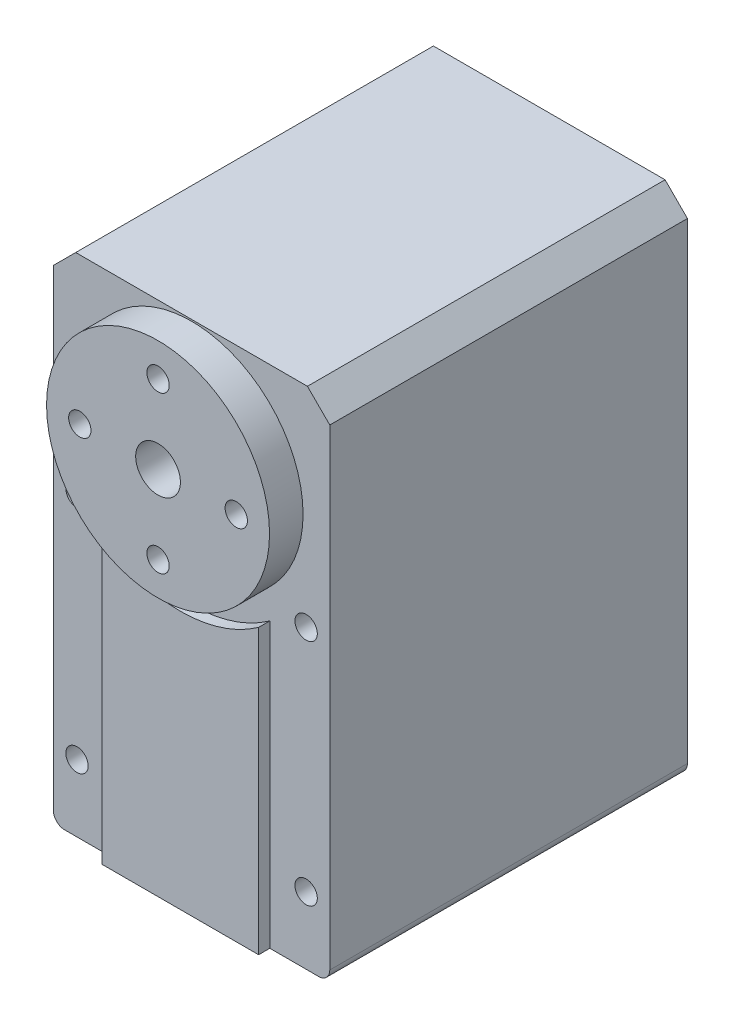
from build123d import *

# Parameters (mm, degrees)
SKETCH_1_W          = 24.73
SKETCH_1_H          = 45.23
EXTRUDE_1_DEPTH     = 32
CHAMFER_1_SIZE      = 2
EXTRUDE_2_DEPTH     = 1
SKETCH_3_R          = 1
CUT_EXTRUDE_1_DEPTH = 4
SKETCH_4_R          = 9.975
EXTRUDE_3_DEPTH     = 3
SKETCH_5_R          = 2
SKETCH_5_R_2        = 1
CUT_EXTRUDE_2_DEPTH = 3
SKETCH_6_W          = 20.33
SKETCH_6_H          = 12
EXTRUDE_4_DEPTH     = 2
CHAMFER_2_SIZE      = 2
SKETCH_7_W          = 22.33
SKETCH_7_H          = 5
CUT_EXTRUDE_3_DEPTH = 2
SKETCH_8_R          = 3
EXTRUDE_5_DEPTH     = 4.1
CUT_EXTRUDE_START   = -4
SKETCH_9_R          = 1
CUT_EXTRUDE_4_DEPTH = 4
FILLET_1_R          = 1


with BuildPart() as part:
    # 스케치1 → 보스-돌출1 (new body)
    with BuildSketch(Plane.XY):
        Rectangle(SKETCH_1_W, SKETCH_1_H)
    extrude(amount=EXTRUDE_1_DEPTH)

    # 모따기1
    chamfer_1_edges = [part.edges().sort_by_distance(p)[0] for p in [
        (-12.365, 22.615, 16),
        (12.365, 22.615, 16),
    ]]
    chamfer(chamfer_1_edges, length=CHAMFER_1_SIZE)

    # 스케치2 → 보스-돌출2 (add)
    with BuildSketch(Plane.XY.offset(32)):
        with BuildLine():
            Line((-7, -22.615), (7, -22.615))
            Line((7, -22.615), (7, 2.753205655))
            ThreePointArc((7, 2.753205655), (0, 0.5), (-7, 2.753205655))
            Line((-7, 2.753205655), (-7, -22.615))
        make_face()
    extrude(amount=EXTRUDE_2_DEPTH)

    # 스케치3 → 컷-돌출1 (cut)
    with BuildSketch(Plane.XY.offset(32)):
        with Locations((-10.25, 3.885)):
            Circle(SKETCH_3_R)
        with Locations((-10.25, -16.615)):
            Circle(SKETCH_3_R)
        with Locations((10.25, -16.615)):
            Circle(SKETCH_3_R)
        with Locations((10.25, 3.885)):
            Circle(SKETCH_3_R)
    extrude(amount=-CUT_EXTRUDE_1_DEPTH, mode=Mode.SUBTRACT)

    # 스케치4 → 보스-돌출3 (add)
    with BuildSketch(Plane.XY.offset(32)):
        with Locations((0, 12.5)):
            Circle(SKETCH_4_R)
    extrude(amount=EXTRUDE_3_DEPTH)

    # 스케치5 → 컷-돌출2 (cut)
    with BuildSketch(Plane.XY.offset(35)):
        with Locations((0, 12.5)):
            Circle(SKETCH_5_R)
        with Locations((0, 19.5)):
            Circle(SKETCH_5_R_2)
        with Locations((7, 12.5)):
            Circle(SKETCH_5_R_2)
        with Locations((0, 5.5)):
            Circle(SKETCH_5_R_2)
        with Locations((-7, 12.5)):
            Circle(SKETCH_5_R_2)
    extrude(amount=-CUT_EXTRUDE_2_DEPTH, mode=Mode.SUBTRACT)

    # 스케치6 → 보스-돌출4 (add)
    with BuildSketch(Plane(origin=(0, 0, 0), x_dir=(-1, 0, 0), z_dir=(0, 0, -1))):
        with Locations((0, -12.115)):
            Rectangle(SKETCH_6_W, SKETCH_6_H)
    extrude(amount=EXTRUDE_4_DEPTH)

    # 모따기2
    chamfer_2_edges = [part.edges().sort_by_distance(p)[0] for p in [
        (0, -6.115, -2),
    ]]
    chamfer(chamfer_2_edges, length=CHAMFER_2_SIZE - 0.0001)  # a hair under: the kernel refuses the full size

    # 스케치7 → 컷-돌출3 (cut)
    with BuildSketch(Plane(origin=(0, 0, 0), x_dir=(-1, 0, 0), z_dir=(0, 0, -1))):
        with Locations((0, -3.615)):
            Rectangle(SKETCH_7_W, SKETCH_7_H)
    extrude(amount=-CUT_EXTRUDE_3_DEPTH, mode=Mode.SUBTRACT)

    # 스케치8 → 보스-돌출5 (add)
    with BuildSketch(Plane(origin=(0, 0, 0), x_dir=(-1, 0, 0), z_dir=(0, 0, -1))):
        with Locations(Location((0, 12.5, 0), (0, 0, 180))):
            Circle(SKETCH_8_R)
    extrude(amount=EXTRUDE_5_DEPTH)

    # 스케치9 → 컷-돌출4 (cut)
    with BuildSketch(Plane(origin=(0, 0, 0), x_dir=(-1, 0, 0), z_dir=(0, 0, -1)).offset(CUT_EXTRUDE_START)):
        with Locations(Location((-10.25, 3.885, 0), (0, 0, 180))):
            Circle(SKETCH_9_R)
        with Locations(Location((10.25, 3.885, 0), (0, 0, 180))):
            Circle(SKETCH_9_R)
        with Locations((-10.25, -20.615)):
            Circle(SKETCH_9_R)
        with Locations((10.25, -20.615)):
            Circle(SKETCH_9_R)
    extrude(amount=CUT_EXTRUDE_4_DEPTH, mode=Mode.SUBTRACT)

    # 필렛1
    fillet_1_edges = [part.edges().sort_by_distance(p)[0] for p in [
        (12.365, -22.615, 16),
        (-12.365, -22.615, 16),
    ]]
    fillet(fillet_1_edges, radius=FILLET_1_R)


solid = part.part
